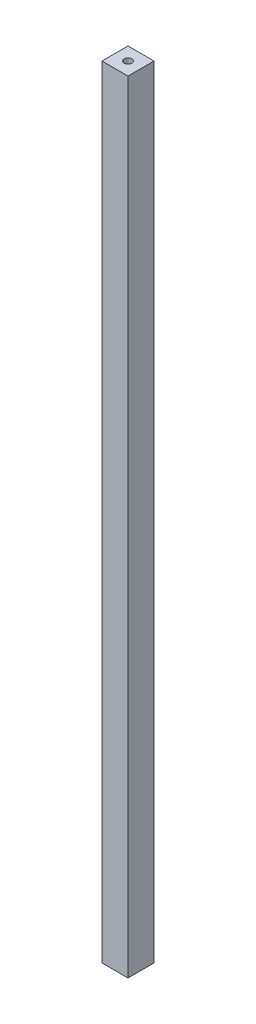
from build123d import *

# Parameters (mm, degrees)
SKETCH1_W                   = 10
SKETCH1_H                   = 10
BOSS_EXTRUDE1_DEPTH         = 300
F_32_0_116_DIAMETER_HOLE1_D = 2.9464


with BuildPart() as part:
    # Sketch1 → Boss-Extrude1 (new body)
    with BuildSketch(Plane(origin=(0, 0, 0), x_dir=(1, 0, 0), z_dir=(0, 1, 0))):
        with Locations((5, 5)):
            Rectangle(SKETCH1_W, SKETCH1_H)
    extrude(amount=BOSS_EXTRUDE1_DEPTH)

    # #32 (0.116) Diameter Hole1 (through all)
    with Locations(Plane(origin=(0, 300, 0), x_dir=(1, 0, 0), z_dir=(0, 1, 0))):
        with Locations((5, 5)):
            Hole(F_32_0_116_DIAMETER_HOLE1_D / 2)


solid = part.part
